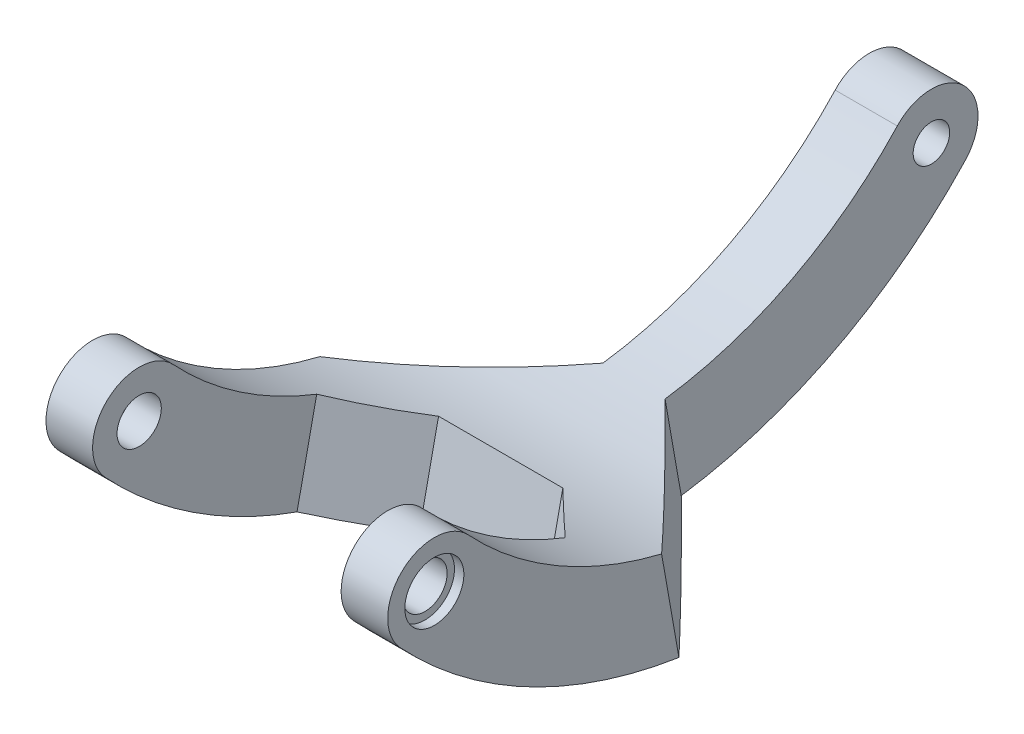
from build123d import *

# Parameters (mm, degrees)
SKETCH_1_R               = 1.175
SKETCH_1_R_2             = 1.425
EXTRUDE_1_DEPTH          = 11
CUT_EXTRUDE_1_DEPTH      = 8
CUT_EXTRUDE_1_DEPTH_BACK = 8
SKETCH_1_6_R             = 1.425
SKETCH_4_R               = 1.175
CUT_EXTRUDE_3_DEPTH      = 9
CUT_EXTRUDE_START        = -0.6
SKETCH_6_R               = 1.9
CUT_EXTRUDE_5_DEPTH      = 35.929603411
SKETCH_3_R               = 1.85
CUT_EXTRUDE_2_DEPTH      = 1
CHAMFER_2_SIZE           = 10
CHAMFER_3_SIZE           = 4


with BuildPart() as part:
    # 草图1 → 凸台-拉伸1 (new, symmetric)
    with BuildSketch(Plane(origin=(0, 0, 0), x_dir=(0, 0, -1), z_dir=(1, 0, 0))):
        with BuildLine():
            ThreePointArc((-22.696428571, -2.043453335), (0, -11.927768877), (22.696428571, -2.043453335))
            ThreePointArc((22.696428571, -2.043453335), (22.543453335, 2.196428571), (18.303571429, 2.043453335))
            ThreePointArc((18.303571429, 2.043453335), (0, -5.927768877), (-18.303571429, 2.043453335))
            ThreePointArc((-18.303571429, 2.043453335), (-22.543453335, 2.196428571), (-22.696428571, -2.043453335))
        make_face()
        with Locations((20.5, 0)):
            Circle(SKETCH_1_R, mode=Mode.SUBTRACT)
        with Locations((-20.5, 0)):
            Circle(SKETCH_1_R_2, mode=Mode.SUBTRACT)
    extrude(amount=EXTRUDE_1_DEPTH, both=True)

    # 草图1<6> → 切除-拉伸1 (cut, two sides: drawn at the far end of the back side and taken through both)
    with BuildSketch(Plane(origin=(0, 0, 0), x_dir=(0, 0, -1), z_dir=(1, 0, 0)).offset(-CUT_EXTRUDE_1_DEPTH_BACK)):
        with BuildLine():
            ThreePointArc((-22.696428571, -2.043453335), (-15.296359873, -7.89110277), (-6.48036682, -11.242861585))
            Line((-6.48036682, -11.242861585), (-5.226102274, -5.375424287))
            ThreePointArc((-5.226102274, -5.375424287), (-12.335774091, -2.672392985), (-18.303571429, 2.043453335))
            ThreePointArc((-18.303571429, 2.043453335), (-22.543453335, 2.196428571), (-22.696428571, -2.043453335))
        make_face()
        with Locations((-20.5, 0)):
            Circle(SKETCH_1_6_R, mode=Mode.SUBTRACT)
    extrude(amount=CUT_EXTRUDE_1_DEPTH + CUT_EXTRUDE_1_DEPTH_BACK, mode=Mode.SUBTRACT)

    # 草图4 → 切除-拉伸3 (cut)
    with BuildSketch(Plane(origin=(11, 0, 0), x_dir=(0, 0, -1), z_dir=(1, 0, 0))):
        with BuildLine():
            ThreePointArc((18.303571429, 2.043453335), (11.941686142, -2.891287085), (4.341204442, -5.547962703))
            Line((4.341204442, -5.547962703), (5.383093508, -11.456809221))
            ThreePointArc((5.383093508, -11.456809221), (14.807690816, -8.162531455), (22.696428571, -2.043453335))
            ThreePointArc((22.696428571, -2.043453335), (23.487928503, 0.268855462), (22.296358841, 2.402726558))
            ThreePointArc((22.296358841, 2.402726558), (20.231144538, 2.987928503), (18.303571429, 2.043453335))
        make_face()
        with Locations((20.5, 0)):
            Circle(SKETCH_4_R, mode=Mode.SUBTRACT)
    cut_extrude_3 = extrude(amount=-CUT_EXTRUDE_3_DEPTH, mode=Mode.SUBTRACT)

    # 草图6 → 切除-拉伸5 (cut)
    with BuildSketch(Plane(origin=(11, 0, 0), x_dir=(0, 0, -1), z_dir=(1, 0, 0)).offset(CUT_EXTRUDE_START)):
        with Locations(Location((-20.5, 0, 0), (0, 0, 180))):
            Circle(SKETCH_6_R)
    cut_extrude_5 = extrude(amount=CUT_EXTRUDE_5_DEPTH, mode=Mode.SUBTRACT)

    # 镜向3: 切除-拉伸3, 切除-拉伸5 across plane
    add(cut_extrude_3.mirror(Plane(origin=(0, 0, 0), x_dir=(0, 0, 1), z_dir=(1, 0, 0))), mode=Mode.SUBTRACT)
    add(cut_extrude_5.mirror(Plane(origin=(0, 0, 0), x_dir=(0, 0, 1), z_dir=(1, 0, 0))), mode=Mode.SUBTRACT)

    # 草图3 → 切除-拉伸2 (cut)
    with BuildSketch(Plane.ZY.offset(11)):
        with Locations((20.5, 0)):
            Circle(SKETCH_3_R)
    extrude(amount=-CUT_EXTRUDE_2_DEPTH, mode=Mode.SUBTRACT)

    # 倒角2
    # the kernel refuses this chamfer: 10 mm, written as the material it adds along each edge
    # the kernel refuses this chamfer: 10 mm, written as the material it takes off along each edge
    with BuildSketch(Plane(origin=(-11, 19.778170746, 0.124476202), x_dir=(-0.027495876610586313, -0.1735825242275637, 0.9844354138551714), z_dir=(0, -0.9848077530122094, -0.17364817766692373))) as chamfer_2_2_piece_1_section:
        Polygon((CHAMFER_2_SIZE * 0.999621916911, -CHAMFER_2_SIZE * 0.0274958766106), (-CHAMFER_2_SIZE * 0.0274958766106, -CHAMFER_2_SIZE * 0.999621916911), (0, 0), align=None)
    chamfer_2_2_piece_1 = extrude(amount=57.433659759, mode=Mode.PRIVATE)
    chamfer_2_2_piece_1 = split(chamfer_2_2_piece_1, bisect_by=Plane(origin=(-2, -8.783186583, -1.465639678), z_dir=(-1, 0, 0)), keep=Keep.TOP, mode=Mode.PRIVATE)
    add(chamfer_2_2_piece_1, mode=Mode.SUBTRACT)
    with BuildSketch(Plane(origin=(11, 19.778170746, 0.124476202), x_dir=(-0.9996219169112968, 0.004774608866782908, -0.027078152461972493), z_dir=(0, -0.9848077530122094, -0.17364817766692373))) as chamfer_2_2_piece_2_section:
        Polygon((CHAMFER_2_SIZE * 0.999621916911, -CHAMFER_2_SIZE * 0.0274958766106), (-CHAMFER_2_SIZE * 0.0274958766106, -CHAMFER_2_SIZE * 0.999621916911), (0, 0), align=None)
    chamfer_2_2_piece_2 = extrude(amount=57.433659759, mode=Mode.PRIVATE)
    chamfer_2_2_piece_2 = split(chamfer_2_2_piece_2, bisect_by=Plane(origin=(2, -8.783186583, -1.465639678), z_dir=(1, 0, 0)), keep=Keep.TOP, mode=Mode.PRIVATE)
    add(chamfer_2_2_piece_2, mode=Mode.SUBTRACT)

    # 倒角3
    chamfer_3_edges = [part.edges().sort_by_distance(p)[0] for p in [
        (8, -8.309142936, 5.853234547),
        (-8, -8.309142936, 5.853234547),
    ]]
    chamfer(chamfer_3_edges, length=CHAMFER_3_SIZE)


solid = part.part
